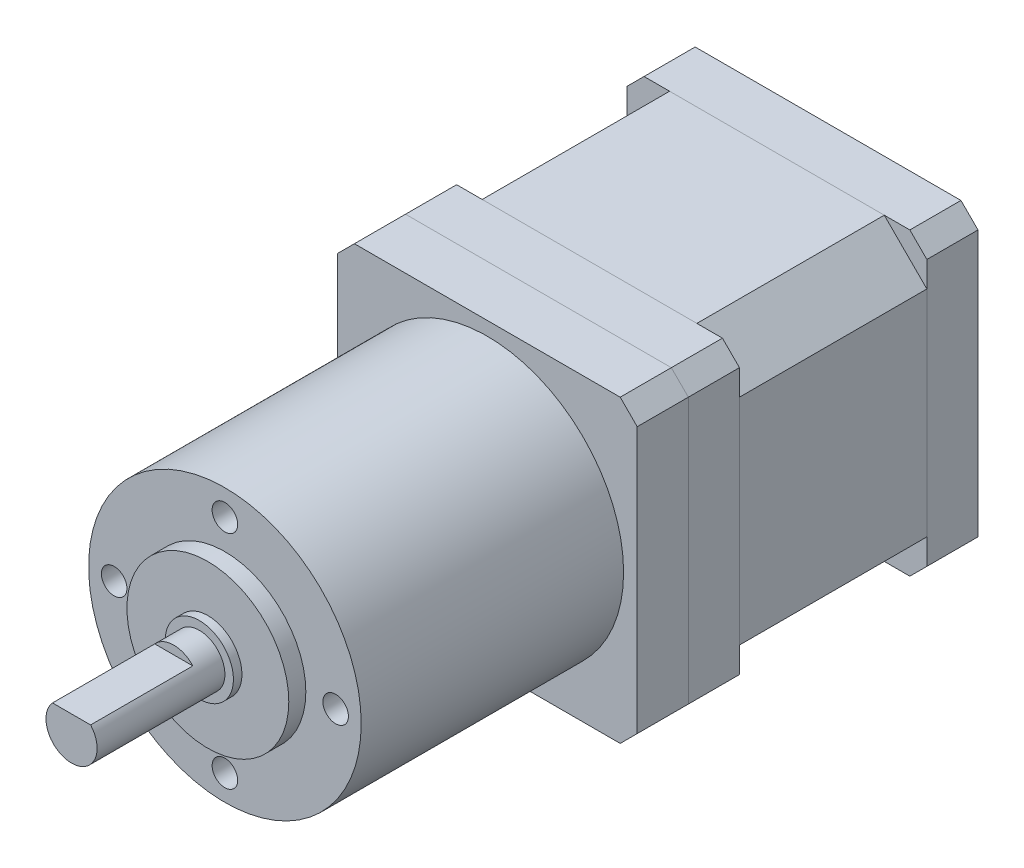
from build123d import *

# Parameters (mm, degrees)
ESQUISSE1_W             = 35.2
ESQUISSE1_H             = 35.2
BOSS_EXTRU_1_DEPTH      = 34
ESQUISSE2_W             = 35.2
ESQUISSE2_H             = 35.2
BOSS_EXTRU_2_DEPTH      = 6
ESQUISSE3_R             = 16
BOSS_EXTRU_3_DEPTH      = 30.8
ESQUISSE4_R             = 9.5
BOSS_EXTRU_4_DEPTH      = 2
ESQUISSE5_R             = 4
BOSS_EXTRU_5_DEPTH      = 1
ESQUISSE6_R             = 3
BOSS_EXTRU_6_DEPTH      = 15
ESQUISSE7_OUTSIDE_W     = 57.56
ESQUISSE7_OUTSIDE_H     = 57.56
ESQUISSE7_OUTSIDE_W_2   = 8.389084627
ESQUISSE7_OUTSIDE_H_2   = 5
ENL_V_MAT_EXTRU_1_DEPTH = 12
ESQUISSE8_R             = 1.5
ENL_V_MAT_EXTRU_2_DEPTH = 8
CHANFREIN1_SIZE         = 2
CHANFREIN2_SIZE         = 2
ESQUISSE9_OUTSIDE_W     = 57.56
ESQUISSE9_OUTSIDE_H     = 57.56
ENL_V_MAT_EXTRU_3_DEPTH = 22


# Read off the part's stored shape, not the designer's step: Intersect1, Intersect2
with BuildPart() as part:
    # Esquisse1 → Boss.-Extru.1 (new body)
    with BuildSketch(Plane.XY):
        Rectangle(ESQUISSE1_W, ESQUISSE1_H)
    extrude(amount=BOSS_EXTRU_1_DEPTH)

    # Chanfrein1
    chanfrein1_edges = [part.edges().sort_by_distance(p)[0] for p in [
        (-17.6, 17.6, 17),
        (17.6, 17.6, 17),
        (17.6, -17.6, 17),
        (-17.6, -17.6, 17),
    ]]
    chamfer(chanfrein1_edges, length=CHANFREIN1_SIZE)

    # Esquisse9 outside → Enlèv. mat.-Extru.3 (cut)
    with BuildSketch(Plane(origin=(0, 0, 6), x_dir=(-1, 0, 0), z_dir=(0, 0, -1))):
        Rectangle(ESQUISSE9_OUTSIDE_W, ESQUISSE9_OUTSIDE_H)
        Polygon((-17.6, -12.6), (-17.6, 12.6), (-12.6, 17.6), (12.6, 17.6), (17.6, 12.6), (17.6, -12.6), (12.6, -17.6), (-12.6, -17.6), align=None, mode=Mode.SUBTRACT)
    extrude(amount=-ENL_V_MAT_EXTRU_3_DEPTH, mode=Mode.SUBTRACT)


with BuildPart() as body_2:
    # Esquisse2 → Boss.-Extru.2 (new body)
    with BuildSketch(Plane.XY.offset(34)):
        Rectangle(ESQUISSE2_W, ESQUISSE2_H)
    extrude(amount=BOSS_EXTRU_2_DEPTH)

    # Esquisse3 → Boss.-Extru.3 (add)
    with BuildSketch(Plane.XY.offset(40)):
        Circle(ESQUISSE3_R)
    extrude(amount=BOSS_EXTRU_3_DEPTH)

    # Esquisse4 → Boss.-Extru.4 (add)
    with BuildSketch(Plane.XY.offset(70.8)):
        Circle(ESQUISSE4_R)
    extrude(amount=BOSS_EXTRU_4_DEPTH)

    # Esquisse5 → Boss.-Extru.5 (add)
    with BuildSketch(Plane.XY.offset(72.8)):
        Circle(ESQUISSE5_R)
    extrude(amount=BOSS_EXTRU_5_DEPTH)

    # Esquisse8 → Enlèv. mat.-Extru.2 (cut)
    with BuildSketch(Plane.XY.offset(70.8)):
        with Locations((0, 13)):
            Circle(ESQUISSE8_R)
        with Locations((13, 0)):
            Circle(ESQUISSE8_R)
        with Locations((0, -13)):
            Circle(ESQUISSE8_R)
        with Locations((-13, 0)):
            Circle(ESQUISSE8_R)
    extrude(amount=-ENL_V_MAT_EXTRU_2_DEPTH, mode=Mode.SUBTRACT)

    # Chanfrein2
    chanfrein2_edges = [body_2.edges().sort_by_distance(p)[0] for p in [
        (17.6, 17.6, 37),
        (17.6, -17.6, 37),
        (-17.6, -17.6, 37),
        (-17.6, 17.6, 37),
    ]]
    chamfer(chanfrein2_edges, length=CHANFREIN2_SIZE)


with BuildPart() as body_3:
    # Esquisse6 → Boss.-Extru.6 (new body)
    with BuildSketch(Plane.XY.offset(73.8)):
        Circle(ESQUISSE6_R)
    extrude(amount=BOSS_EXTRU_6_DEPTH)

    # Esquisse7 outside → Enlèv. mat.-Extru.1 (cut)
    with BuildSketch(Plane.XY.offset(88.8)):
        Rectangle(ESQUISSE7_OUTSIDE_W, ESQUISSE7_OUTSIDE_H)
        with Locations((0.120470513, -0.5)):
            Rectangle(ESQUISSE7_OUTSIDE_W_2, ESQUISSE7_OUTSIDE_H_2, mode=Mode.SUBTRACT)
    extrude(amount=-ENL_V_MAT_EXTRU_1_DEPTH, mode=Mode.SUBTRACT)


with BuildPart() as body_4:
    # Intersect1: the piece on the far side of the plane
    add(part.part)
    split(bisect_by=Plane.XY.offset(28), keep=Keep.BOTTOM)


with BuildPart() as part_1:
    add(part.part)

    # Intersect1
    split(bisect_by=Plane.XY.offset(28), keep=Keep.TOP)


with BuildPart() as body_5:
    # Intersect2: the piece on the far side of the plane
    add(body_4.part)
    split(bisect_by=Plane.XY.offset(6), keep=Keep.BOTTOM)


with BuildPart() as body_4_1:
    add(body_4.part)

    # Intersect2
    split(bisect_by=Plane.XY.offset(6), keep=Keep.TOP)


solid = Compound([body_2.part, body_3.part, part_1.part, body_5.part, body_4_1.part])
